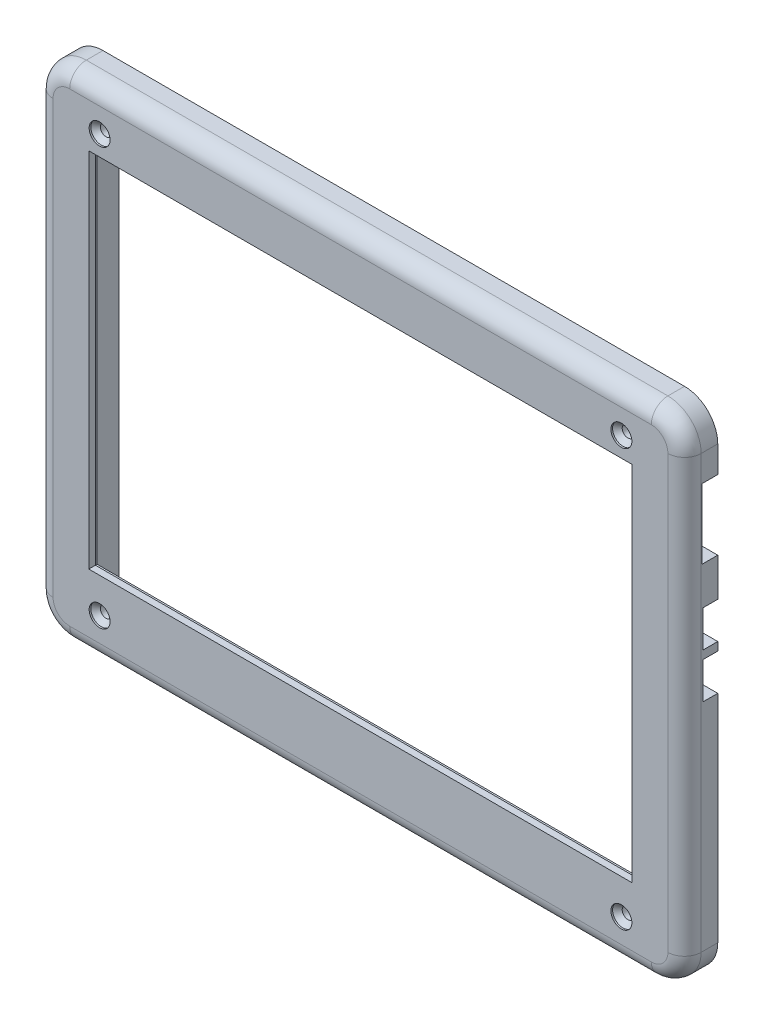
from build123d import *

# Parameters (mm, degrees)
BOSS_EXTRU_1_DEPTH      = 10
ESQUISSE2_W             = 163.5
ESQUISSE2_H             = 109
ENL_V_MAT_EXTRU_1_DEPTH = 10
ESQUISSE3_W             = 164.5
ESQUISSE3_H             = 110
ENL_V_MAT_EXTRU_2_DEPTH = 8
ENL_V_MAT_EXTRU_3_DEPTH = 7
ESQUISSE5_R             = 3.5
BOSS_EXTRU_2_DEPTH      = 4
CONG_1_R                = 5
ESQUISSE6_W             = 12.13
ESQUISSE6_H             = 21
ESQUISSE6_W_2           = 8
ESQUISSE6_H_2           = 11
ENL_V_MAT_EXTRU_4_DEPTH = 97.5


# Read off the part's stored shape, not the designer's step: Fraisage pour vis à tête fraisée M31
with BuildPart() as part:
    # Esquisse1 → Boss.-Extru.1 (new body)
    with BuildSketch(Plane.XY):
        with BuildLine():
            Line((87.5, -75), (-87.5, -75))
            ThreePointArc((-87.5, -75), (-94.571067812, -72.071067812), (-97.5, -65))
            Line((-97.5, -65), (-97.5, 65))
            ThreePointArc((-97.5, 65), (-94.571067812, 72.071067812), (-87.5, 75))
            Line((-87.5, 75), (87.5, 75))
            ThreePointArc((87.5, 75), (94.571067812, 72.071067812), (97.5, 65))
            Line((97.5, 65), (97.5, -65))
            ThreePointArc((97.5, -65), (94.571067812, -72.071067812), (87.5, -75))
        make_face()
    extrude(amount=BOSS_EXTRU_1_DEPTH)

    # Esquisse2 → Enlèv. mat.-Extru.1 (cut)
    with BuildSketch(Plane.XY.offset(10)):
        with Locations((0, 2.25)):
            Rectangle(ESQUISSE2_W, ESQUISSE2_H)
    extrude(amount=-ENL_V_MAT_EXTRU_1_DEPTH, mode=Mode.SUBTRACT)

    # Esquisse3 → Enlèv. mat.-Extru.2 (cut)
    with BuildSketch(Plane(origin=(0, 0, 0), x_dir=(-1, 0, 0), z_dir=(0, 0, -1))):
        with Locations((0, 2.25)):
            Rectangle(ESQUISSE3_W, ESQUISSE3_H)
    extrude(amount=-ENL_V_MAT_EXTRU_2_DEPTH, mode=Mode.SUBTRACT)

    # Esquisse4 → Enlèv. mat.-Extru.3 (cut)
    with BuildSketch(Plane(origin=(0, 0, 0), x_dir=(-1, 0, 0), z_dir=(0, 0, -1))):
        with BuildLine():
            Line((-74.305753882, -63.01), (74.305753882, -63.01))
            ThreePointArc((74.305753882, -63.01), (78.51, -67.214246118), (82.714246118, -63.01))
            Line((82.714246118, -63.01), (82.714246118, 63.01))
            ThreePointArc((82.714246118, 63.01), (78.51, 67.214246118), (74.305753882, 63.01))
            Line((74.305753882, 63.01), (-74.305753882, 63.01))
            ThreePointArc((-74.305753882, 63.01), (-78.51, 67.214246118), (-82.714246118, 63.01))
            Line((-82.714246118, 63.01), (-82.714246118, -63.01))
            ThreePointArc((-82.714246118, -63.01), (-78.51, -67.214246118), (-74.305753882, -63.01))
        make_face()
    extrude(amount=-ENL_V_MAT_EXTRU_3_DEPTH, mode=Mode.SUBTRACT)

    # Esquisse5 → Boss.-Extru.2 (add)
    with BuildSketch(Plane(origin=(0, 0, 7), x_dir=(-1, 0, 0), z_dir=(0, 0, -1))):
        with Locations((-78.5, -62.75)):
            Circle(ESQUISSE5_R)
        with Locations((78.5, -62.75)):
            Circle(ESQUISSE5_R)
        with Locations((78.5, 62.75)):
            Circle(ESQUISSE5_R)
        with Locations((-78.5, 62.75)):
            Circle(ESQUISSE5_R)
    extrude(amount=BOSS_EXTRU_2_DEPTH)

    # Congé1
    cong_1_edges = [part.edges().sort_by_distance(p)[0] for p in [
        (-94.571067812, 72.071067812, 10),
        (-97.5, 0, 10),
        (-94.571067812, -72.071067812, 10),
        (0, -75, 10),
        (94.571067812, -72.071067812, 10),
        (97.5, 0, 10),
        (94.571067812, 72.071067812, 10),
        (0, 75, 10),
    ]]
    fillet(cong_1_edges, radius=CONG_1_R)

    # Esquisse6 → Enlèv. mat.-Extru.4 (cut)
    with BuildSketch(Plane(origin=(0, 0, 0), x_dir=(0, 0, -1), z_dir=(1, 0, 0))):
        with Locations((1.265, 46.5)):
            Rectangle(ESQUISSE6_W, ESQUISSE6_H)
        with Locations((-0.5, 19)):
            Rectangle(ESQUISSE6_W_2, ESQUISSE6_H_2)
        with Locations((-0.5, 5.5)):
            Rectangle(ESQUISSE6_W_2, ESQUISSE6_H_2)
    extrude(amount=ENL_V_MAT_EXTRU_4_DEPTH, mode=Mode.SUBTRACT)

    # Fraisage pour vis à tête fraisée M31 out → Fraisage pour vis à tête fraisée M31 (revolve, cut)
    with BuildSketch(Plane(origin=(-78.5, -62.75, 0), x_dir=(1, 0, 0), z_dir=(0, -1, 0))):
        Polygon((0, 3), (1.7, 3), (1.7, 8.05), (3.15, 9.5), (3.15, 10), (0, 10), align=None)
    revolve(axis=Axis((-78.5, -62.75, 0), (0, 0, 1)), mode=Mode.SUBTRACT)

    # Fraisage pour vis _ t_te frais_e M31 2 o → Fraisage pour vis _ t_te frais_e M31 2 (revolve, cut)
    with BuildSketch(Plane(origin=(78.5, -62.75, 0), x_dir=(1, 0, 0), z_dir=(0, -1, 0))):
        Polygon((0, 3), (1.7, 3), (1.7, 8.05), (3.15, 9.5), (3.15, 10), (0, 10), align=None)
    revolve(axis=Axis((78.5, -62.75, 0), (0, 0, 1)), mode=Mode.SUBTRACT)

    # Fraisage pour vis _ t_te frais_e M31 3 o → Fraisage pour vis _ t_te frais_e M31 3 (revolve, cut)
    with BuildSketch(Plane(origin=(78.5, 62.75, 0), x_dir=(1, 0, 0), z_dir=(0, -1, 0))):
        Polygon((0, 3), (1.7, 3), (1.7, 8.05), (3.15, 9.5), (3.15, 10), (0, 10), align=None)
    revolve(axis=Axis((78.5, 62.75, 0), (0, 0, 1)), mode=Mode.SUBTRACT)

    # Fraisage pour vis _ t_te frais_e M31 4 o → Fraisage pour vis _ t_te frais_e M31 4 (revolve, cut)
    with BuildSketch(Plane(origin=(-78.5, 62.75, 0), x_dir=(1, 0, 0), z_dir=(0, -1, 0))):
        Polygon((0, 3), (1.7, 3), (1.7, 8.05), (3.15, 9.5), (3.15, 10), (0, 10), align=None)
    revolve(axis=Axis((-78.5, 62.75, 0), (0, 0, 1)), mode=Mode.SUBTRACT)


solid = part.part
